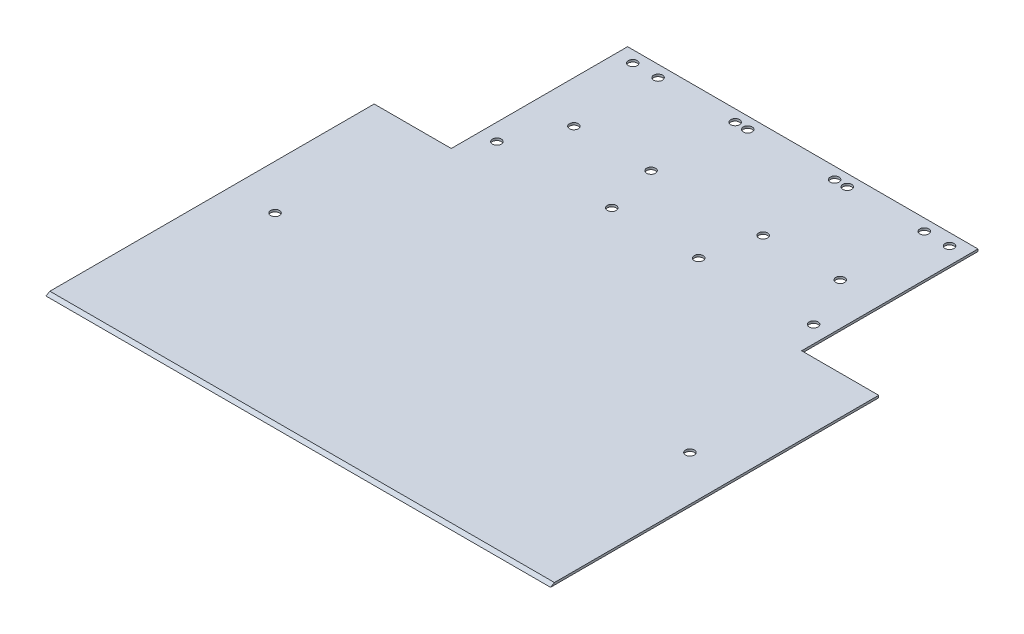
from build123d import *

# Parameters (mm, degrees)
SALIENTE_EXTRUIR1_DEPTH = 0.8
CORTAR_EXTRUIR1_REACH   = 203.248
CORTAR_EXTRUIR2_REACH   = 129.282
CROQUIS3_R              = 1.585
CORTAR_EXTRUIR3_REACH   = 129.282
CROQUIS4_R              = 1.585
CORTAR_EXTRUIR4_REACH   = 129.282
CROQUIS6_R              = 1.585
CORTAR_EXTRUIR5_REACH   = 129.282
CROQUIS7_R              = 1.585


with BuildPart() as part:
    # Croquis1 → Saliente-Extruir1 (new body)
    with BuildSketch(Plane(origin=(0, 0, 0), x_dir=(1, 0, 0), z_dir=(0, 1, 0))):
        Polygon((-62.5, 90), (-62.5, 27.08), (-90, 27.08), (-90, -90), (90, -90), (90, 27.08), (62.5, 27.08), (62.5, 90), align=None)
    extrude(amount=SALIENTE_EXTRUIR1_DEPTH)

    # Croquis2 → Cortar-Extruir1 (cut, up to next)
    with BuildSketch(Plane.ZY.offset(90), mode=Mode.PRIVATE) as cortar_extruir1_sk1:
        Polygon((90, 0), (88.614359354, 0.8), (90, 0.8), align=None)
    cortar_extruir1_tool1 = extrude(cortar_extruir1_sk1.sketch, amount=-CORTAR_EXTRUIR1_REACH, mode=Mode.PRIVATE) & part.part
    add(cortar_extruir1_tool1.solids().sort_by_distance((-90, 0.533333, 89.53812))[0], mode=Mode.SUBTRACT)

    # Croquis3 → Cortar-Extruir2 (cut, up to next)
    with BuildSketch(Plane(origin=(0, 0.8, 0), x_dir=(1, 0, 0), z_dir=(0, 1, 0)), mode=Mode.PRIVATE) as cortar_extruir2_sk1:
        with Locations((74, -24.279339937)):
            Circle(CROQUIS3_R)
    cortar_extruir2_tool1 = extrude(cortar_extruir2_sk1.sketch, amount=-CORTAR_EXTRUIR2_REACH, mode=Mode.PRIVATE) & part.part
    cortar_extruir2 = cortar_extruir2_tool1.solids().sort_by_distance((74, 0.8, 24.27934))[0]
    add(cortar_extruir2, mode=Mode.SUBTRACT)

    # Simetría1: Cortar-Extruir2 across plane
    add(cortar_extruir2.mirror(Plane(origin=(0, 0, 0), x_dir=(0, 0, 1), z_dir=(1, 0, 0))), mode=Mode.SUBTRACT)

    # Croquis4 → Cortar-Extruir3 (cut, up to next)
    with BuildSketch(Plane(origin=(0, 0.8, 0), x_dir=(1, 0, 0), z_dir=(0, 1, 0)), mode=Mode.PRIVATE) as cortar_extruir3_sk1:
        with Locations((-56.5, 37.351063887)):
            Circle(CROQUIS4_R)
    cortar_extruir3_tool1 = extrude(cortar_extruir3_sk1.sketch, amount=-CORTAR_EXTRUIR3_REACH, mode=Mode.PRIVATE) & part.part
    # Croquis4 → Cortar-Extruir3 (cut, up to next)
    with BuildSketch(Plane(origin=(0, 0.8, 0), x_dir=(1, 0, 0), z_dir=(0, 1, 0)), mode=Mode.PRIVATE) as cortar_extruir3_sk2:
        with Locations((-15.5, 37.351063887)):
            Circle(CROQUIS4_R)
    cortar_extruir3_tool2 = extrude(cortar_extruir3_sk2.sketch, amount=-CORTAR_EXTRUIR3_REACH, mode=Mode.PRIVATE) & part.part
    # Croquis4 → Cortar-Extruir3 (cut, up to next)
    with BuildSketch(Plane(origin=(0, 0.8, 0), x_dir=(1, 0, 0), z_dir=(0, 1, 0)), mode=Mode.PRIVATE) as cortar_extruir3_sk3:
        with Locations((-15.5, 85.851063887)):
            Circle(CROQUIS4_R)
    cortar_extruir3_tool3 = extrude(cortar_extruir3_sk3.sketch, amount=-CORTAR_EXTRUIR3_REACH, mode=Mode.PRIVATE) & part.part
    # Croquis4 → Cortar-Extruir3 (cut, up to next)
    with BuildSketch(Plane(origin=(0, 0.8, 0), x_dir=(1, 0, 0), z_dir=(0, 1, 0)), mode=Mode.PRIVATE) as cortar_extruir3_sk4:
        with Locations((-56.5, 85.851063887)):
            Circle(CROQUIS4_R)
    cortar_extruir3_tool4 = extrude(cortar_extruir3_sk4.sketch, amount=-CORTAR_EXTRUIR3_REACH, mode=Mode.PRIVATE) & part.part
    add(cortar_extruir3_tool1.solids().sort_by_distance((-56.5, 0.8, -37.351064))[0], mode=Mode.SUBTRACT)
    add(cortar_extruir3_tool2.solids().sort_by_distance((-15.5, 0.8, -37.351064))[0], mode=Mode.SUBTRACT)
    add(cortar_extruir3_tool3.solids().sort_by_distance((-15.5, 0.8, -85.851064))[0], mode=Mode.SUBTRACT)
    add(cortar_extruir3_tool4.solids().sort_by_distance((-56.5, 0.8, -85.851064))[0], mode=Mode.SUBTRACT)

    # Croquis6 → Cortar-Extruir4 (cut, up to next)
    with BuildSketch(Plane(origin=(0, 0.8, 0), x_dir=(1, 0, 0), z_dir=(0, 1, 0)), mode=Mode.PRIVATE) as cortar_extruir4_sk1:
        with Locations((56.5, 85.851063887)):
            Circle(CROQUIS6_R)
    cortar_extruir4_tool1 = extrude(cortar_extruir4_sk1.sketch, amount=-CORTAR_EXTRUIR4_REACH, mode=Mode.PRIVATE) & part.part
    # Croquis6 → Cortar-Extruir4 (cut, up to next)
    with BuildSketch(Plane(origin=(0, 0.8, 0), x_dir=(1, 0, 0), z_dir=(0, 1, 0)), mode=Mode.PRIVATE) as cortar_extruir4_sk2:
        with Locations((15.5, 85.851063887)):
            Circle(CROQUIS6_R)
    cortar_extruir4_tool2 = extrude(cortar_extruir4_sk2.sketch, amount=-CORTAR_EXTRUIR4_REACH, mode=Mode.PRIVATE) & part.part
    # Croquis6 → Cortar-Extruir4 (cut, up to next)
    with BuildSketch(Plane(origin=(0, 0.8, 0), x_dir=(1, 0, 0), z_dir=(0, 1, 0)), mode=Mode.PRIVATE) as cortar_extruir4_sk3:
        with Locations((15.5, 37.351063887)):
            Circle(CROQUIS6_R)
    cortar_extruir4_tool3 = extrude(cortar_extruir4_sk3.sketch, amount=-CORTAR_EXTRUIR4_REACH, mode=Mode.PRIVATE) & part.part
    # Croquis6 → Cortar-Extruir4 (cut, up to next)
    with BuildSketch(Plane(origin=(0, 0.8, 0), x_dir=(1, 0, 0), z_dir=(0, 1, 0)), mode=Mode.PRIVATE) as cortar_extruir4_sk4:
        with Locations((56.5, 37.351063887)):
            Circle(CROQUIS6_R)
    cortar_extruir4_tool4 = extrude(cortar_extruir4_sk4.sketch, amount=-CORTAR_EXTRUIR4_REACH, mode=Mode.PRIVATE) & part.part
    add(cortar_extruir4_tool1.solids().sort_by_distance((56.5, 0.8, -85.851064))[0], mode=Mode.SUBTRACT)
    add(cortar_extruir4_tool2.solids().sort_by_distance((15.5, 0.8, -85.851064))[0], mode=Mode.SUBTRACT)
    add(cortar_extruir4_tool3.solids().sort_by_distance((15.5, 0.8, -37.351064))[0], mode=Mode.SUBTRACT)
    add(cortar_extruir4_tool4.solids().sort_by_distance((56.5, 0.8, -37.351064))[0], mode=Mode.SUBTRACT)

    # Croquis7 → Cortar-Extruir5 (cut, up to next)
    with BuildSketch(Plane(origin=(0, 0.8, 0), x_dir=(1, 0, 0), z_dir=(0, 1, 0)), mode=Mode.PRIVATE) as cortar_extruir5_sk1:
        with Locations((-20, 85.851063887)):
            Circle(CROQUIS7_R)
    cortar_extruir5_tool1 = extrude(cortar_extruir5_sk1.sketch, amount=-CORTAR_EXTRUIR5_REACH, mode=Mode.PRIVATE) & part.part
    # Croquis7 → Cortar-Extruir5 (cut, up to next)
    with BuildSketch(Plane(origin=(0, 0.8, 0), x_dir=(1, 0, 0), z_dir=(0, 1, 0)), mode=Mode.PRIVATE) as cortar_extruir5_sk2:
        with Locations((-47.5, 85.851063887)):
            Circle(CROQUIS7_R)
    cortar_extruir5_tool2 = extrude(cortar_extruir5_sk2.sketch, amount=-CORTAR_EXTRUIR5_REACH, mode=Mode.PRIVATE) & part.part
    # Croquis7 → Cortar-Extruir5 (cut, up to next)
    with BuildSketch(Plane(origin=(0, 0.8, 0), x_dir=(1, 0, 0), z_dir=(0, 1, 0)), mode=Mode.PRIVATE) as cortar_extruir5_sk3:
        with Locations((-47.5, 55.851063887)):
            Circle(CROQUIS7_R)
    cortar_extruir5_tool3 = extrude(cortar_extruir5_sk3.sketch, amount=-CORTAR_EXTRUIR5_REACH, mode=Mode.PRIVATE) & part.part
    # Croquis7 → Cortar-Extruir5 (cut, up to next)
    with BuildSketch(Plane(origin=(0, 0.8, 0), x_dir=(1, 0, 0), z_dir=(0, 1, 0)), mode=Mode.PRIVATE) as cortar_extruir5_sk4:
        with Locations((-20, 55.851063887)):
            Circle(CROQUIS7_R)
    cortar_extruir5_tool4 = extrude(cortar_extruir5_sk4.sketch, amount=-CORTAR_EXTRUIR5_REACH, mode=Mode.PRIVATE) & part.part
    cortar_extruir5_1 = cortar_extruir5_tool1.solids().sort_by_distance((-20, 0.8, -85.851064))[0]
    add(cortar_extruir5_1, mode=Mode.SUBTRACT)
    cortar_extruir5_2 = cortar_extruir5_tool2.solids().sort_by_distance((-47.5, 0.8, -85.851064))[0]
    add(cortar_extruir5_2, mode=Mode.SUBTRACT)
    cortar_extruir5_3 = cortar_extruir5_tool3.solids().sort_by_distance((-47.5, 0.8, -55.851064))[0]
    add(cortar_extruir5_3, mode=Mode.SUBTRACT)
    cortar_extruir5_4 = cortar_extruir5_tool4.solids().sort_by_distance((-20, 0.8, -55.851064))[0]
    add(cortar_extruir5_4, mode=Mode.SUBTRACT)
    cortar_extruir5 = cortar_extruir5_1 + cortar_extruir5_2 + cortar_extruir5_3 + cortar_extruir5_4  # Cortar-Extruir5 as one shape, for the pattern or mirror that repeats it

    # Simetría2: Cortar-Extruir5 across plane
    add(cortar_extruir5.mirror(Plane(origin=(0, 0, 0), x_dir=(0, 0, 1), z_dir=(1, 0, 0))), mode=Mode.SUBTRACT)


solid = part.part
